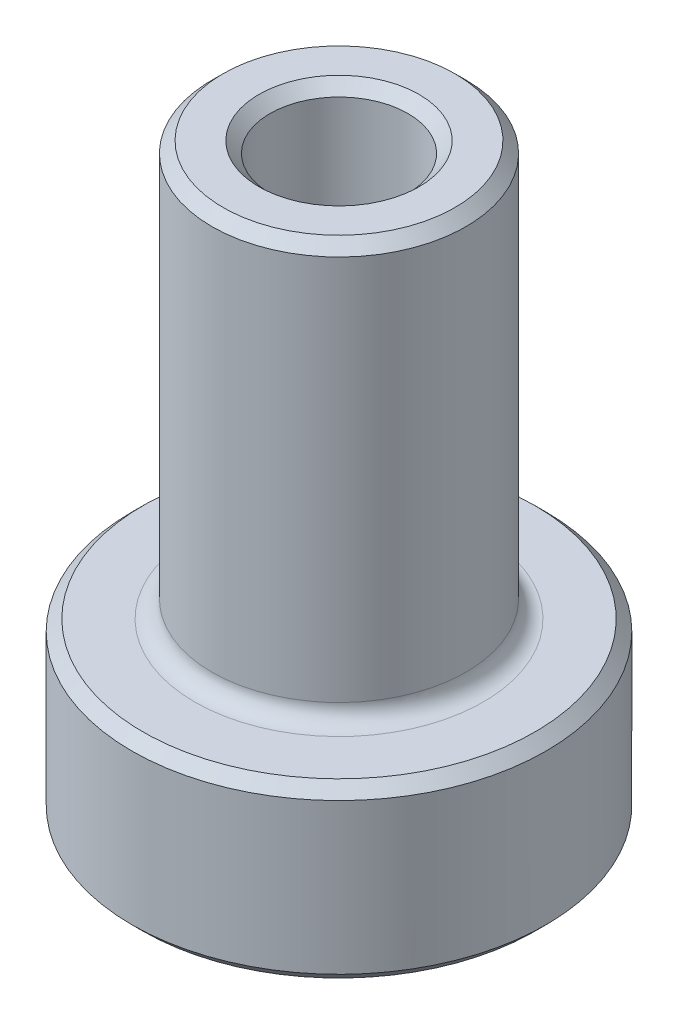
from build123d import *

# Parameters (mm, degrees)
CUT_EXTRUDE1_DEPTH = 2.38125
FILLET1_R          = 0.396875
FILLET2_R          = 0.79375
CHAMFER1_SIZE      = 0.254


with BuildPart() as part:
    # Sketch1 → Revolve1 (revolve)
    with BuildSketch(Plane.XY):
        Polygon((1.5875, 0), (4.7625, 0), (4.7625, 3.96875), (2.921, 3.96875), (2.921, 13.49375), (1.5875, 13.49375), align=None)
    revolve(axis=Axis((0, 7.886499903, 0), (0, -1, 0)))

    # Sketch2 → Cut-Extrude1 (cut)
    with BuildSketch(Plane.XZ):
        Polygon((1.75976362, 3.048), (-1.75976362, 3.048), (-3.519527241, 0), (-1.75976362, -3.048), (1.75976362, -3.048), (3.519527241, 0), align=None)
    extrude(amount=-CUT_EXTRUDE1_DEPTH, mode=Mode.SUBTRACT)

    # Fillet1
    fillet1_edges = [part.edges().sort_by_distance(p)[0] for p in [
        (-2.921, 3.96875, 0),
    ]]
    fillet(fillet1_edges, radius=FILLET1_R)

    # Fillet2
    fillet2_edges = [part.edges().sort_by_distance(p)[0] for p in [
        (2.639645431, 2.38125, -1.524),
        (0, 2.38125, -3.048),
        (-2.639645431, 2.38125, -1.524),
        (-2.639645431, 2.38125, 1.524),
        (2.639645431, 2.38125, 1.524),
        (0, 2.38125, 3.048),
        (3.519527241, 1.190625, 0),
        (1.75976362, 1.190625, -3.048),
        (-1.75976362, 1.190625, -3.048),
        (-3.519527241, 1.190625, 0),
        (1.75976362, 1.190625, 3.048),
        (-1.75976362, 1.190625, 3.048),
    ]]
    fillet(fillet2_edges, radius=FILLET2_R)

    # Chamfer1
    chamfer1_edges = [part.edges().sort_by_distance(p)[0] for p in [
        (-4.7625, 0, 0),
        (-4.7625, 3.96875, 0),
        (-1.5875, 13.49375, 0),
        (-2.921, 13.49375, 0),
        (-1.5875, 2.38125, 0),
        (0, 0, -3.048),
        (1.698366844, 0, -2.941657664),
        (-1.698366844, 0, -2.941657664),
        (2.639645431, 0, -1.524),
        (-2.639645431, 0, -1.524),
        (3.396733689, 0, 0),
        (-3.396733689, 0, 0),
        (2.639645431, 0, 1.524),
        (-2.639645431, 0, 1.524),
        (1.698366844, 0, 2.941657664),
        (-1.698366844, 0, 2.941657664),
        (0, 0, 3.048),
    ]]
    chamfer(chamfer1_edges, length=CHAMFER1_SIZE)


solid = part.part
